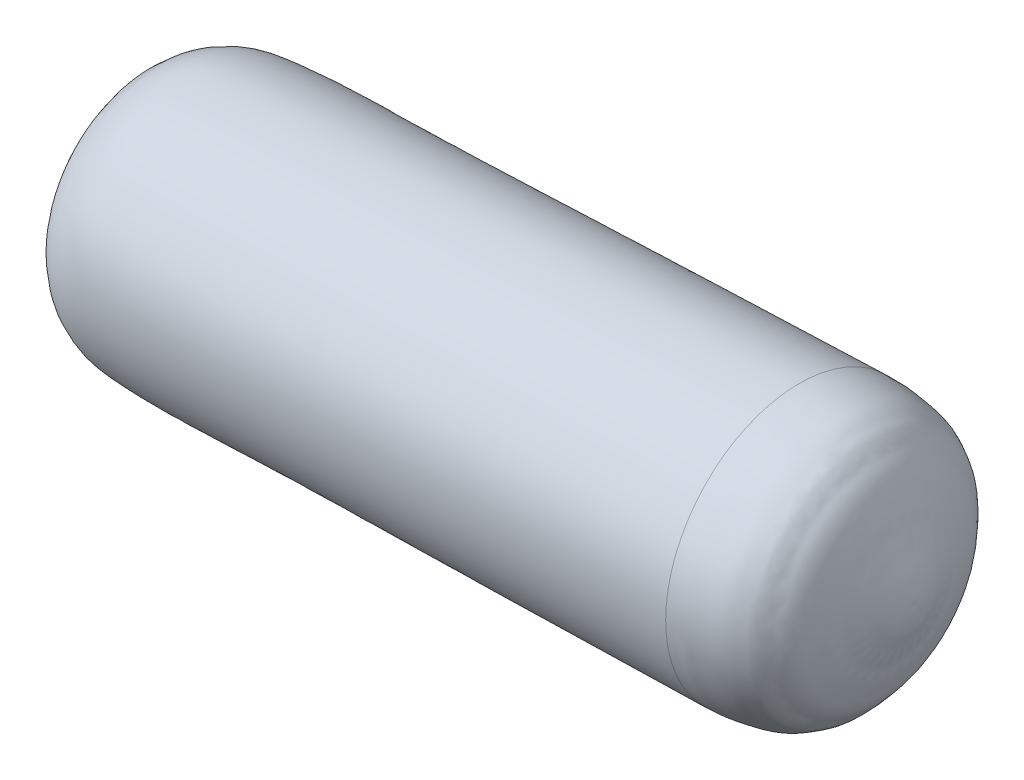
from build123d import *


with BuildPart() as part:
    # Sketch1 → Revolve1 (revolve)
    with BuildSketch(Plane(origin=(0.021243153, 0, 0.632017133), x_dir=(0, -1, 0), z_dir=(-0.033592702192552934, 0, -0.9994356059093564))):
        with BuildLine():
            Line((-0.105, -0.373135931), (-0.105, 0.407304022))
            Line((-0.105, 0.407304022), (-0.1384141, 0.40855655))
            add(Edge.make_bspline(
                [(-0.1384141, 0.40855655), (-0.136238125, 0.405265221), (-0.145021924, 0.396443873), (-0.160290999, 0.391773758), (-0.177632829, 0.382231341), (-0.189647485, 0.375821345), (-0.201166523, 0.369417829), (-0.209057619, 0.363438681), (-0.215227201, 0.356064664), (-0.220716687, 0.349453648), (-0.223788187, 0.342845597), (-0.226825003, 0.336461721), (-0.22977819, 0.328693293), (-0.231793597, 0.31872822), (-0.2331072, 0.306470238), (-0.234323502, 0.289195602), (-0.235260855, 0.266408041), (-0.235656608, 0.230514281), (-0.234751216, 0.16094806), (-0.235488559, 0.064209883), (-0.236517297, -0.047627361), (-0.236953707, -0.134107223), (-0.2373502, -0.203399652), (-0.237375794, -0.239590503), (-0.237692916, -0.258830342)],
                knots=[0, 0, 0, 0, 0.010719594, 0.049534106, 0.066049195, 0.093708236, 0.106676444, 0.121341161, 0.134878114, 0.146949418, 0.157191348, 0.165282814, 0.176645252, 0.191942848, 0.207773151, 0.2283596, 0.264583111, 0.30344036, 0.378941801, 0.556452707, 0.709285089, 0.848168665, 0.919272178, 1, 1, 1, 1], degree=3))
            add(Edge.make_bspline(
                [(-0.105, -0.373135931), (-0.109786375, -0.373907924), (-0.118275908, -0.372160534), (-0.129664969, -0.370570719), (-0.138229728, -0.366817322), (-0.145557436, -0.364072043), (-0.152977868, -0.362004472), (-0.161159914, -0.357833591), (-0.171501846, -0.356234783), (-0.181468791, -0.351531679), (-0.190841828, -0.34840902), (-0.199069961, -0.344396076), (-0.20604672, -0.339712286), (-0.210686549, -0.334842238), (-0.215063409, -0.331818205), (-0.218364476, -0.328579374), (-0.222328392, -0.324829254), (-0.225254377, -0.31924007), (-0.228530188, -0.313983594), (-0.231511942, -0.307758031), (-0.23345589, -0.299858909), (-0.234943035, -0.291169372), (-0.236042131, -0.282925914), (-0.237367279, -0.275613453), (-0.237202827, -0.267664413), (-0.237695683, -0.262021714), (-0.237692916, -0.258830342)],
                knots=[0, 0, 0, 0, 0.072946969, 0.129019552, 0.173641869, 0.213635955, 0.247594121, 0.290001434, 0.351652985, 0.403880472, 0.456070309, 0.501119998, 0.542111046, 0.582547248, 0.602392078, 0.62235014, 0.652552367, 0.684276044, 0.716974574, 0.746536195, 0.788272482, 0.839552233, 0.880063976, 0.914244739, 0.951736113, 1, 1, 1, 1], degree=3))
        make_face()
    revolve(axis=Axis((0.394057556, 0.105, 0.619486218), (-0.9994356059093565, 0, 0.03359270219255294)))


solid = part.part
